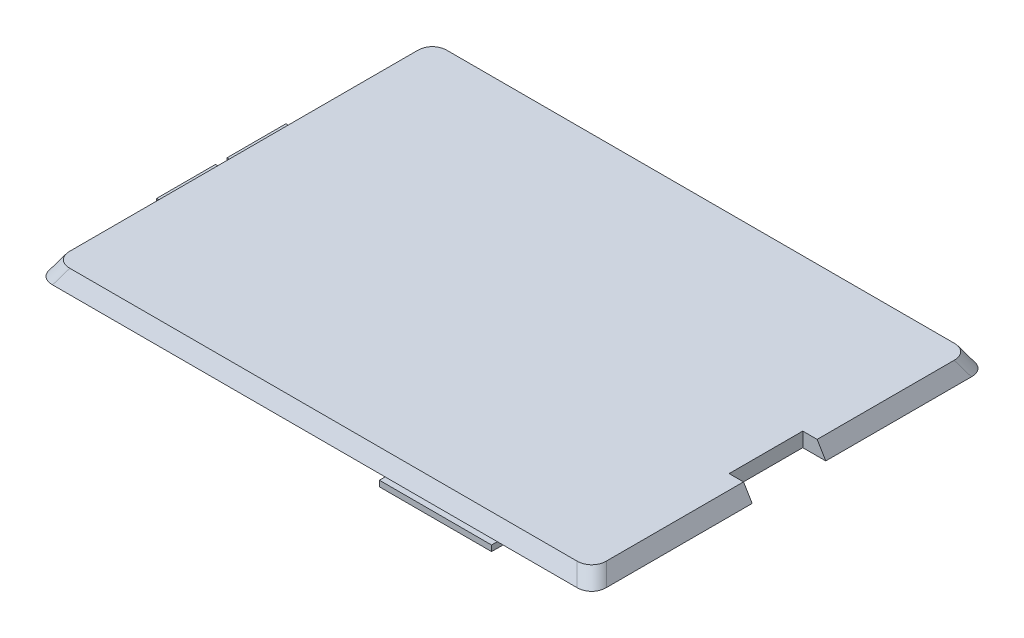
from build123d import *

# Parameters (mm, degrees)
SKETCH3_W           = 4
SKETCH3_H           = 12.8
CUT_EXTRUDE1_DEPTH  = 60.170622077
SKETCH4_W           = 19.5
SKETCH4_H           = 2
SKETCH4_W_2         = 1.5
SKETCH4_H_2         = 14.3
BOSS_EXTRUDE1_DEPTH = 1
BOSS_EXTRUDE2_DEPTH = 0.6
SKETCH6_W           = 19.5
SKETCH6_H           = 3.3
BOSS_EXTRUDE3_DEPTH = 1
FILLET1_R           = 3


with BuildPart() as part:
    # Sketch1 → Loft1 section 0
    with BuildSketch(Plane(origin=(0, 0, 0), x_dir=(1, 0, 0), z_dir=(0, 1, 0))):
        with BuildLine():
            Line((-48.15, -34.3), (48.15, -34.3))
            Line((48.15, -34.3), (48.15, 34.3))
            Line((48.15, 34.3), (-48.15, 34.3))
            Line((-48.15, 34.3), (-48.15, -34.3))
        make_face()
    # Sketch2 → Loft1 section 1
    with BuildSketch(Plane(origin=(0, 2.5, 0), x_dir=(1, 0, 0), z_dir=(0, 1, 0))):
        with BuildLine():
            Line((-46.65, -32.8), (46.65, -32.8))
            Line((46.65, -32.8), (46.65, 32.8))
            Line((46.65, 32.8), (-46.65, 32.8))
            Line((-46.65, 32.8), (-46.65, -32.8))
        make_face()
    loft()

    # Sketch3 → Cut-Extrude1 (cut, through all)
    with BuildSketch(Plane.XZ):
        with Locations((46.15, 0)):
            Rectangle(SKETCH3_W, SKETCH3_H)
    extrude(amount=-CUT_EXTRUDE1_DEPTH, mode=Mode.SUBTRACT)

    # Sketch4 → Boss-Extrude1 (add)
    with BuildSketch(Plane.XZ):
        with Locations((21, 32)):
            Rectangle(SKETCH4_W, SKETCH4_H)
        with Locations((21, -32)):
            Rectangle(SKETCH4_W, SKETCH4_H)
        with Locations((-46.1, 0)):
            Rectangle(SKETCH4_W_2, SKETCH4_H_2)
    extrude(amount=BOSS_EXTRUDE1_DEPTH)

    # Sketch5 → Boss-Extrude2 (add)
    with BuildSketch(Plane.XZ.offset(1)):
        Polygon((-50.55, -11.25), (-45.35, -11.25), (-45.35, 11.25), (-50.55, 11.25), (-50.55, 1), (-48.55, 1), (-48.55, -1), (-50.55, -1), align=None)
    extrude(amount=BOSS_EXTRUDE2_DEPTH)

    # Sketch6 → Boss-Extrude3 (add)
    with BuildSketch(Plane.XZ.offset(1)):
        with Locations((21, 32.65)):
            Rectangle(SKETCH6_W, SKETCH6_H)
        with Locations((21, -32.65)):
            Rectangle(SKETCH6_W, SKETCH6_H)
    extrude(amount=BOSS_EXTRUDE3_DEPTH)

    # Fillet1
    # the kernel refuses this fillet: 3 mm, written as the material it takes off along each edge
    with BuildSketch(Plane(origin=(-50.76627907, -4.360465116, 36.91627907), x_dir=(-0.23537960143467007, -0.3922993357244589, -0.8892118276421003), z_dir=(0.4574957109978059, 0.7624928516630279, -0.45749571099781455)), Plane(origin=(50.76627907, -4.360465116, -36.91627907), x_dir=(0.2353796014346717, -0.39229933572445586, 0.8892118276421013), z_dir=(-0.4574957109978127, 0.7624928516630248, 0.4574957109978127)), Plane(origin=(-50.76627907, -4.360465116, -36.91627907), x_dir=(0.8892118276421047, -0.39229933572444886, -0.23537960143466988), z_dir=(0.4574957109978059, 0.7624928516630279, 0.45749571099781455))) as fillet1_piece_1:
        with BuildLine():
            CenterArc((FILLET1_R * 0.762492851663, -FILLET1_R), FILLET1_R, 90, 74.650522983)
            Line((-FILLET1_R * 0.201836343087, -FILLET1_R * 0.735294117647), (0, 0))
            Line((0, 0), (FILLET1_R * 0.762492851663, 0))
        make_face()
    extrude(amount=14.716112037, mode=Mode.SUBTRACT)
    with BuildSketch(Plane(origin=(50.76627907, -4.360465116, 36.91627907), x_dir=(0.2353796014346717, -0.39229933572445586, -0.8892118276421013), z_dir=(-0.4574957109978127, 0.7624928516630248, -0.4574957109978127))) as fillet1_piece_2:
        with BuildLine():
            CenterArc((FILLET1_R * 0.762492851663, FILLET1_R), FILLET1_R, 195.349477017, 74.650522983)
            Line((-FILLET1_R * 0.201836343087, FILLET1_R * 0.735294117647), (0, 0))
            Line((0, 0), (FILLET1_R * 0.762492851663, 0))
        make_face()
    extrude(amount=14.716112037, mode=Mode.SUBTRACT)


solid = part.part
